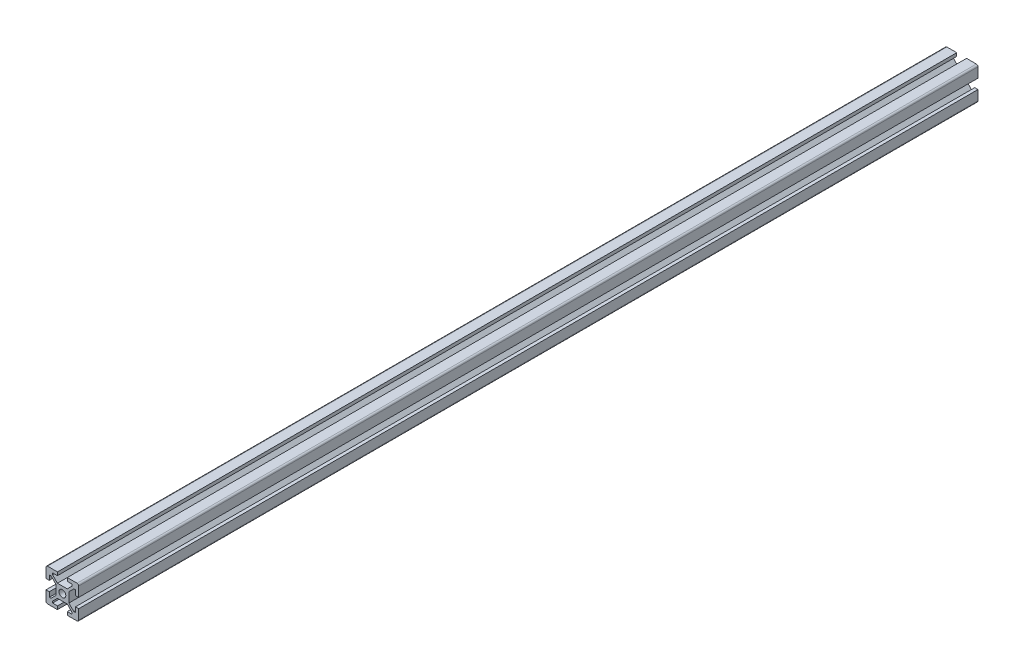
from build123d import *

# Parameters (mm, degrees)
SCHIZZO1_R                   = 2.1
ESTRUSIONE_ESTRUSIONE1_DEPTH = 550
RACCORDO1_R                  = 1


with BuildPart() as part:
    # Schizzo1 → Estrusione-Estrusione1 (new body)
    with BuildSketch(Plane.XY):
        Polygon((10, 3), (10, 10), (3, 10), (3, 8), (6, 8), (6, 7), (3, 4), (-3, 4), (-6, 7), (-6, 8), (-3, 8), (-3, 10), (-10, 10), (-10, 3), (-8, 3), (-8, 6), (-7, 6), (-4, 3), (-4, -3), (-7, -6), (-8, -6), (-8, -3), (-10, -3), (-10, -10), (-3, -10), (-3, -8), (-6, -8), (-6, -7), (-3, -4), (3, -4), (6, -7), (6, -8), (3, -8), (3, -10), (10, -10), (10, -3), (8, -3), (8, -6), (7, -6), (4, -3), (4, 3), (7, 6), (8, 6), (8, 3), align=None)
        Circle(SCHIZZO1_R, mode=Mode.SUBTRACT)
    extrude(amount=ESTRUSIONE_ESTRUSIONE1_DEPTH)

    # Raccordo1
    raccordo1_edges = [part.edges().sort_by_distance(p)[0] for p in [
        (-10, -10, 275),
        (10, -10, 275),
        (-10, 10, 275),
        (10, 10, 275),
    ]]
    fillet(raccordo1_edges, radius=RACCORDO1_R)


solid = part.part
